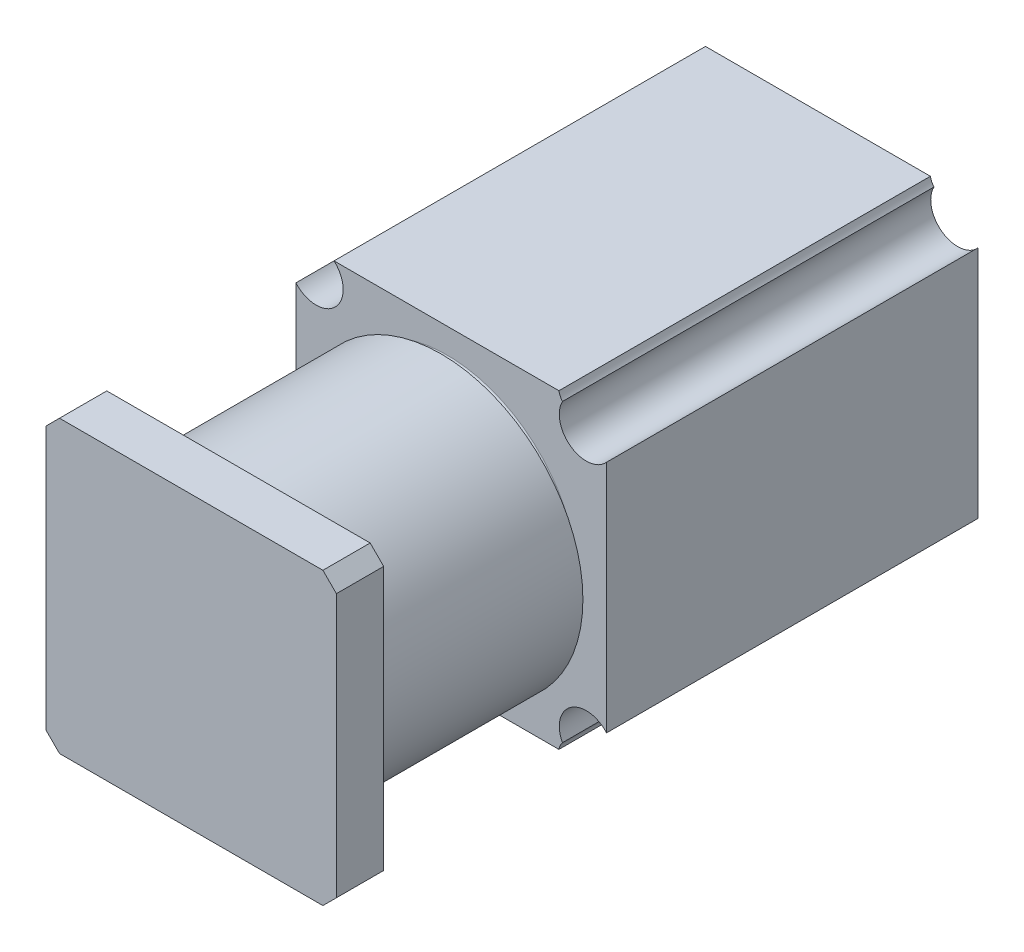
from build123d import *

# Parameters (mm, degrees)
SKETCH_1_W                  = 55
SKETCH_1_H                  = 46
EXTRUDE_1_DEPTH             = 46
SKETCH_2_R                  = 19
EXTRUDE_2_DEPTH             = 2
FILLET_1_R                  = 0.3
HOLE_WIZARD_11_0_11_1_D     = 11
HOLE_WIZARD_11_0_11_1_DEPTH = 2
SKETCH_5_R                  = 3.175
EXTRUDE_3_DEPTH             = 21
CUT_EXTRUDE_START           = -18
CUT_EXTRUDE_1_DEPTH         = 18
HOLE_WIZARD_8_0_8_1_DEPTH   = 55
HOLE_WIZARD_5_2_5_2_2_D     = 5.2
HOLE_WIZARD_5_2_5_2_2_DEPTH = 55
HOLE_WIZARD_2_0_2_1_D       = 2
HOLE_WIZARD_2_0_2_1_DEPTH   = 10
CHAMFER_1_SIZE              = 0.5
CHAMFER_2_SIZE              = 0.1
SKETCH_15_R                 = 21
EXTRUDE_4_DEPTH             = 30
SKETCH_16_W                 = 43
SKETCH_16_H                 = 43
EXTRUDE_5_DEPTH             = 7
CHAMFER_3_SIZE              = 2


# Read off the part's stored shape, not the designer's step: Ø8.0 (8) 直径孔1
with BuildPart() as part:
    # 草图1 → 凸台-拉伸1 (new body)
    with BuildSketch(Plane(origin=(28, 0, 0), x_dir=(0, 0, -1), z_dir=(1, 0, 0))):
        with Locations((-27.5, 0)):
            Rectangle(SKETCH_1_W, SKETCH_1_H)
    extrude(amount=-EXTRUDE_1_DEPTH)

    # 草图2 → 凸台-拉伸2 (add)
    with BuildSketch(Plane.XY.offset(55)):
        with Locations((4.421826919, 0)):
            Circle(SKETCH_2_R)
    extrude(amount=EXTRUDE_2_DEPTH)

    # 圆角1
    fillet_1_edges = [part.edges().sort_by_distance(p)[0] for p in [
        (-14.578173081, 0, 55),
    ]]
    fillet(fillet_1_edges, radius=FILLET_1_R)

    # Ø11.0 (11) 直径孔1
    with Locations(Plane.XY.offset(57)):
        with Locations((0, 0)):
            Hole(HOLE_WIZARD_11_0_11_1_D / 2, depth=HOLE_WIZARD_11_0_11_1_DEPTH)

    # 草图5 → 凸台-拉伸3 (add)
    with BuildSketch(Plane.XY.offset(55)):
        with Locations(Location((0, 0, 0), (0, 0, 180))):
            Circle(SKETCH_5_R)
    extrude(amount=EXTRUDE_3_DEPTH)

    # 草图6 → 切除-拉伸1 (cut)
    with BuildSketch(Plane.XY.offset(76).offset(CUT_EXTRUDE_START)):
        with BuildLine():
            Line((-2.107130751, 2.375), (2.107130751, 2.375))
            ThreePointArc((2.107130751, 2.375), (0, 3.175), (-2.107130751, 2.375))
        make_face()
    extrude(amount=CUT_EXTRUDE_1_DEPTH, mode=Mode.SUBTRACT)

    # Ø8.0 (8) 直径孔1 outline → Ø8.0 (8) 直径孔1 (cut)
    with BuildSketch(Plane.XY):
        with BuildLine():
            ThreePointArc((-12.354248689, -23), (-12.171572875, -17.171572875), (-18, -17.354248689))
            Line((-18, -17.354248689), (-18, -23))
            Line((-18, -23), (-12.354248689, -23))
        make_face()
        with BuildLine():
            Line((-18, 23), (-18, 17.354248689))
            ThreePointArc((-18, 17.354248689), (-12.171572875, 17.171572875), (-12.354248689, 23))
            Line((-12.354248689, 23), (-18, 23))
        make_face()
        with BuildLine():
            ThreePointArc((28, -17.354248689), (22.171572875, -17.171572875), (22.354248689, -23))
            Line((22.354248689, -23), (28, -23))
            Line((28, -23), (28, -17.354248689))
        make_face()
        with BuildLine():
            Line((28, 23), (22.354248689, 23))
            ThreePointArc((22.354248689, 23), (22.171572875, 17.171572875), (28, 17.354248689))
            Line((28, 17.354248689), (28, 23))
        make_face()
    extrude(amount=HOLE_WIZARD_8_0_8_1_DEPTH, mode=Mode.SUBTRACT)

    # Ø5.2 (5.2) 直径孔2
    with Locations(Plane.XY.offset(55)):
        with Locations((23.5, 23.5), (23.5, -23.5), (-23.5, 23.5)):
            Hole(HOLE_WIZARD_5_2_5_2_2_D / 2, depth=HOLE_WIZARD_5_2_5_2_2_DEPTH)

    # Ø2.0 (2) 直径孔1
    with Locations(Plane.XY.offset(76)):
        with Locations((0, 0)):
            Hole(HOLE_WIZARD_2_0_2_1_D / 2, depth=HOLE_WIZARD_2_0_2_1_DEPTH)

    # 倒角1
    chamfer_1_edges = [part.edges().sort_by_distance(p)[0] for p in [
        (1.302014759, -2.895752504, 76),
        (0, 2.375, 76),
    ]]
    chamfer(chamfer_1_edges, length=CHAMFER_1_SIZE)

    # 倒角2
    chamfer_2_edges = [part.edges().sort_by_distance(p)[0] for p in [
        (1, 0, 76),
    ]]
    chamfer(chamfer_2_edges, length=CHAMFER_2_SIZE)

    # 草图15 → 凸台-拉伸4 (add)
    with BuildSketch(Plane.XY.offset(57)):
        with Locations((5.5, 0)):
            Circle(SKETCH_15_R)
    extrude(amount=EXTRUDE_4_DEPTH)

    # 草图16 → 凸台-拉伸5 (add)
    with BuildSketch(Plane.XY.offset(87)):
        with Locations((5.5, 0)):
            Rectangle(SKETCH_16_W, SKETCH_16_H)
    extrude(amount=EXTRUDE_5_DEPTH)

    # 倒角3
    chamfer_3_edges = [part.edges().sort_by_distance(p)[0] for p in [
        (27, -21.5, 90.5),
        (27, 21.5, 90.5),
        (-16, 21.5, 90.5),
        (-16, -21.5, 90.5),
    ]]
    chamfer(chamfer_3_edges, length=CHAMFER_3_SIZE)


solid = part.part
